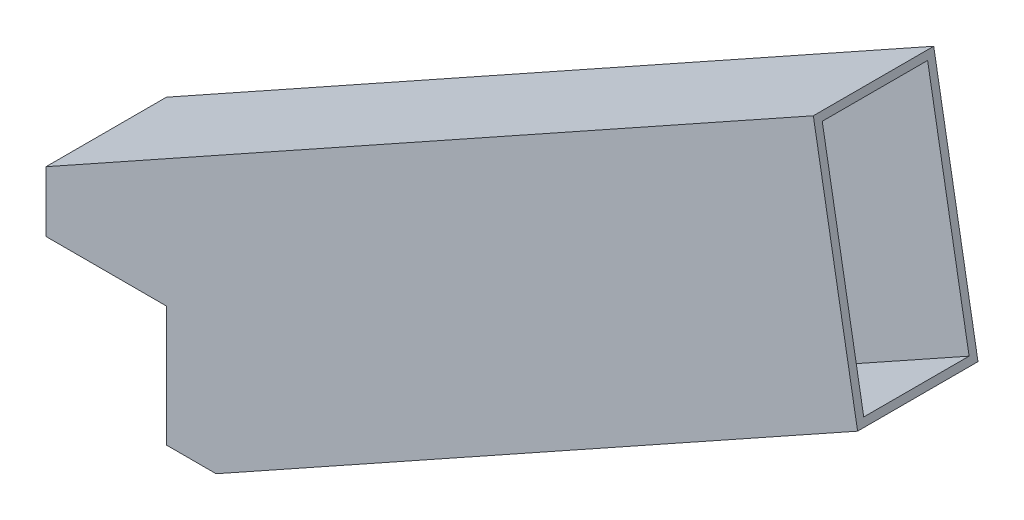
from build123d import *

# Parameters (mm, degrees)
BOSS_EXTRUDE1_DEPTH = 25.4
SHELL1_T            = -1.5875


with BuildPart() as part:
    # Sketch1 → Boss-Extrude1 (new body)
    with BuildSketch(Plane.XY):
        Polygon((139.6492, 131.572), (-22.225, 41.330048013), (-22.225, 28.575), (3.175, 28.575), (3.175, 3.175), (13.660739747, 3.175), (148.986638942, 78.616752285), align=None)
    extrude(amount=BOSS_EXTRUDE1_DEPTH)

    # Shell1
    shell1_openings = [part.faces().sort_by_distance(p)[0] for p in [
        (-9.525, 28.575, 12.7),
        (3.175, 15.875, 12.7),
        (144.317919471, 105.094376143, 12.7),
        (8.417869873, 3.175, 12.7),
        (-22.225, 34.952524006, 12.7),
    ]]
    offset(amount=SHELL1_T, openings=shell1_openings, kind=Kind.INTERSECTION)


solid = part.part
